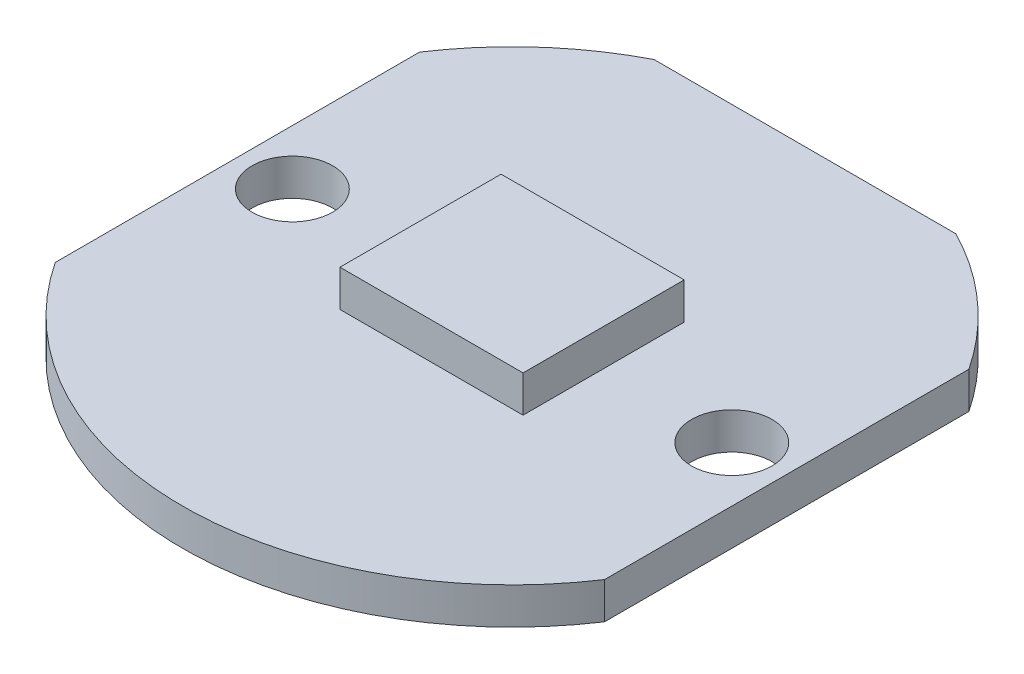
from build123d import *

# Parameters (mm, degrees)
SKETCH_1_R      = 1.1
EXTRUDE_1_DEPTH = 1
EXTRUDE_START   = 1
SKETCH_3_W      = 5
SKETCH_3_H      = 4.4
EXTRUDE_2_DEPTH = 1


with BuildPart() as part:
    # Эскиз1 → Бобышка-Вытянуть1 (new body)
    with BuildSketch(Plane(origin=(0, 0, 0), x_dir=(1, 0, 0), z_dir=(0, 1, 0))):
        with BuildLine():
            Line((4.123105626, 8), (-4.123105626, 8))
            ThreePointArc((-4.123105626, 8), (-6.005155898, 6.703588789), (-7.5, 4.974937186))
            Line((-7.5, 4.974937186), (-7.5, -4.974937186))
            ThreePointArc((-7.5, -4.974937186), (0, -9), (7.5, -4.974937186))
            Line((7.5, -4.974937186), (7.5, 4.974937186))
            ThreePointArc((7.5, 4.974937186), (6.005155898, 6.703588789), (4.123105626, 8))
        make_face()
        with Locations((-6, 0)):
            Circle(SKETCH_1_R, mode=Mode.SUBTRACT)
        with Locations((6, 0)):
            Circle(SKETCH_1_R, mode=Mode.SUBTRACT)
    extrude(amount=EXTRUDE_1_DEPTH)


with BuildPart() as body_2:
    # Эскиз3 → Бобышка-Вытянуть2 (new body)
    with BuildSketch(Plane(origin=(0, 0, 0), x_dir=(1, 0, 0), z_dir=(0, 1, 0)).offset(EXTRUDE_START)):
        Rectangle(SKETCH_3_W, SKETCH_3_H)
    extrude(amount=EXTRUDE_2_DEPTH)


solid = Compound([part.part, body_2.part])
